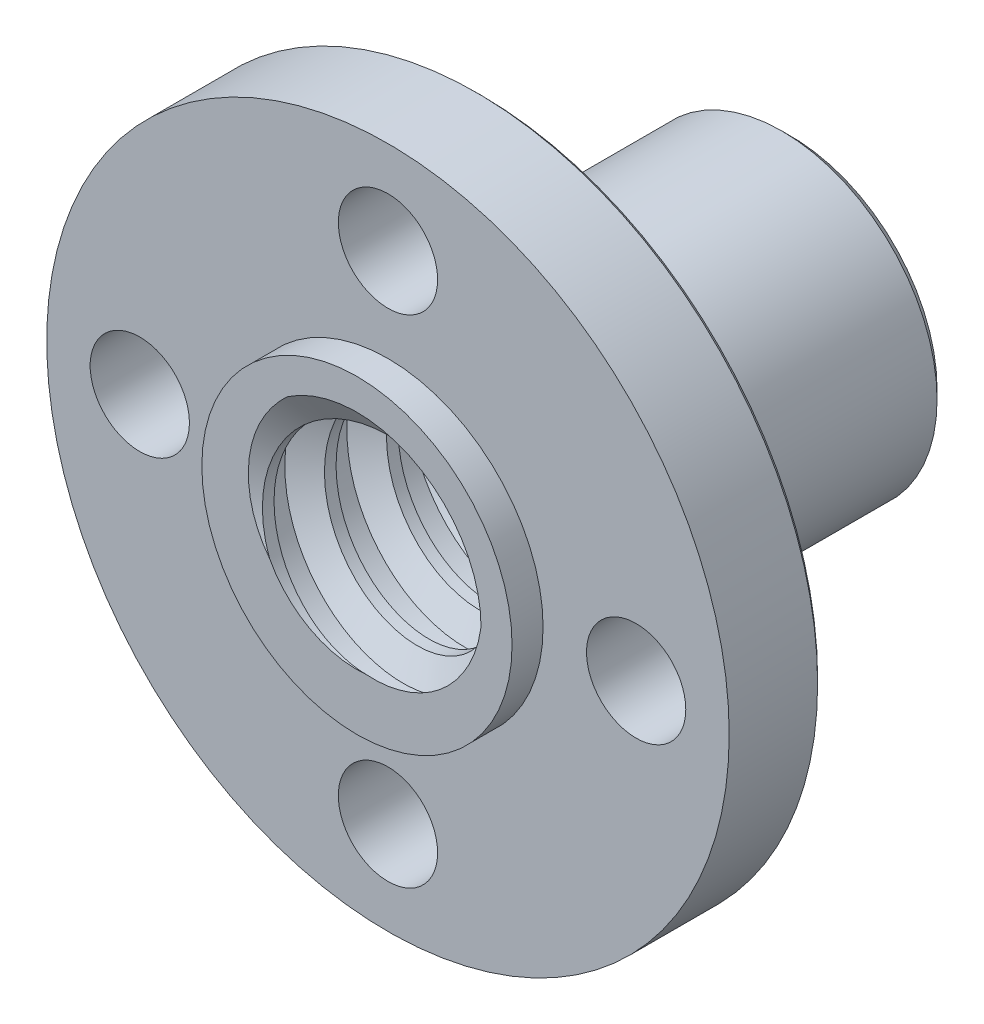
from build123d import *

# Parameters (mm, degrees)
SKETCH1_R           = 5
BOSS_EXTRUDE1_DEPTH = 14
CUT_EXTRUDE1_REACH  = 17.684
SKETCH3_R           = 4
THREAD7_PITCH       = 2
CUT_EXTRUDE2_START  = 14
SKETCH14_R          = 5
CUT_EXTRUDE2_DEPTH  = 14
SKETCH15_R          = 5
CUT_EXTRUDE3_DEPTH  = 14
BOSS_EXTRUDE2_START = -4
SKETCH16_R          = 11
SKETCH16_R_2        = 5
BOSS_EXTRUDE2_DEPTH = 3
CUT_EXTRUDE4_REACH  = 22.273
SKETCH17_R          = 1.6
CHAMFER1_SIZE       = 0.3
CHAMFER2_SIZE       = 0.15


with BuildPart() as part:
    # Sketch1 → Boss-Extrude1 (new body)
    with BuildSketch(Plane.XY):
        Circle(SKETCH1_R)
    extrude(amount=BOSS_EXTRUDE1_DEPTH)

    # Sketch3 → Cut-Extrude1 (cut, up to next)
    with BuildSketch(Plane(origin=(0, 0, 0), x_dir=(-1, 0, 0), z_dir=(0, 0, -1)), mode=Mode.PRIVATE) as cut_extrude1_sk1:
        Circle(SKETCH3_R)
    cut_extrude1_tool1 = extrude(cut_extrude1_sk1.sketch, amount=-CUT_EXTRUDE1_REACH, mode=Mode.PRIVATE) & part.part
    add(cut_extrude1_tool1.solids().sort_by_distance((0, 0, 0))[0], mode=Mode.SUBTRACT)

    # Thread7: the profile of Thread Profile5 profile screwed along a right-hand helix of 8 turns, 10 arcs to a turn; built about Z, then put on its axis
    thread7_z = Axis((0, 0, 0), (0, 0, 1))
    thread7_corners = [(4.0003, 0, -0.000173205), (4.0003, 0, 1.312673201), (3.188101188, 0, 0.843749998), (3.188101188, 0, 0.468749998)]
    with BuildLine(mode=Mode.PRIVATE) as thread7_profile:
        Line(thread7_corners[0], thread7_corners[1])
        Line(thread7_corners[1], thread7_corners[2])
        Line(thread7_corners[2], thread7_corners[3])
        Line(thread7_corners[3], thread7_corners[0])
    thread7_cap = Face(thread7_profile.wire())
    thread7_turn_angles = [0, 18, 36, 54, 72, 90, 108, 126, 144, 162, 180, 198, 216, 234, 252, 270, 288, 306, 324, 342, 360]
    thread7_turn_weights = [1, 0.9510565162951535, 1, 0.9510565162951535, 1, 0.9510565162951535, 1, 0.9510565162951535, 1, 0.9510565162951535, 1, 0.9510565162951535, 1, 0.9510565162951535, 1, 0.9510565162951535, 1, 0.9510565162951535, 1, 0.9510565162951535, 1]
    thread7_turn_rails = [Edge.make_bspline([Vector(p[0], p[1], 0).rotate(thread7_z, thread7_turn_angles[k]) / thread7_turn_weights[k] + Vector(0, 0, p[2] + THREAD7_PITCH * thread7_turn_angles[k] / 360) for k in range(21)], [0, 0, 0, 1, 1, 2, 2, 3, 3, 4, 4, 5, 5, 6, 6, 7, 7, 8, 8, 9, 9, 10, 10, 10], 2, thread7_turn_weights) for p in thread7_corners]
    thread7_turn_sides = [Face.make_surface_from_curves(thread7_turn_rails[p[0]], thread7_turn_rails[p[1]]) for p in [(0, 1), (1, 2), (2, 3), (3, 0)]]
    thread7 = Plane(origin=(0, 0, -2), x_dir=(1, 0, 0), z_dir=(0, 0, 1)) * Solid(Shell([*[p.moved(Location((0, 0, THREAD7_PITCH * i))) for i in range(8) for p in thread7_turn_sides], thread7_cap, thread7_cap.rotate(thread7_z, 2880).moved(Location((0, 0, THREAD7_PITCH * 2880 / 360)))]))
    add(thread7)

    # Sketch14 → Cut-Extrude2 (cut)
    with BuildSketch(Plane(origin=(0, 0, 0), x_dir=(-1, 0, 0), z_dir=(0, 0, -1)).offset(CUT_EXTRUDE2_START)):
        with Locations(Location((0, 0, 0), (0, 0, 180))):
            Circle(SKETCH14_R)
    extrude(amount=-CUT_EXTRUDE2_DEPTH, mode=Mode.SUBTRACT)

    # Sketch15 → Cut-Extrude3 (cut)
    with BuildSketch(Plane.XY.offset(14)):
        Circle(SKETCH15_R)
    extrude(amount=CUT_EXTRUDE3_DEPTH, mode=Mode.SUBTRACT)

    # Sketch16 → Boss-Extrude2 (add)
    with BuildSketch(Plane.XY.offset(14).offset(BOSS_EXTRUDE2_START)):
        Circle(SKETCH16_R)
        Circle(SKETCH16_R_2, mode=Mode.SUBTRACT)
    extrude(amount=BOSS_EXTRUDE2_DEPTH)

    # Sketch17 → Cut-Extrude4 (cut, up to next)
    with BuildSketch(Plane.XY.offset(13), mode=Mode.PRIVATE) as cut_extrude4_sk1:
        with Locations((0, 8)):
            Circle(SKETCH17_R)
    cut_extrude4_tool1 = extrude(cut_extrude4_sk1.sketch, amount=-CUT_EXTRUDE4_REACH, mode=Mode.PRIVATE) & part.part
    # Sketch17 → Cut-Extrude4 (cut, up to next)
    with BuildSketch(Plane.XY.offset(13), mode=Mode.PRIVATE) as cut_extrude4_sk2:
        with Locations((8, 0)):
            Circle(SKETCH17_R)
    cut_extrude4_tool2 = extrude(cut_extrude4_sk2.sketch, amount=-CUT_EXTRUDE4_REACH, mode=Mode.PRIVATE) & part.part
    # Sketch17 → Cut-Extrude4 (cut, up to next)
    with BuildSketch(Plane.XY.offset(13), mode=Mode.PRIVATE) as cut_extrude4_sk3:
        with Locations((0, -8)):
            Circle(SKETCH17_R)
    cut_extrude4_tool3 = extrude(cut_extrude4_sk3.sketch, amount=-CUT_EXTRUDE4_REACH, mode=Mode.PRIVATE) & part.part
    # Sketch17 → Cut-Extrude4 (cut, up to next)
    with BuildSketch(Plane.XY.offset(13), mode=Mode.PRIVATE) as cut_extrude4_sk4:
        with Locations((-8, 0)):
            Circle(SKETCH17_R)
    cut_extrude4_tool4 = extrude(cut_extrude4_sk4.sketch, amount=-CUT_EXTRUDE4_REACH, mode=Mode.PRIVATE) & part.part
    add(cut_extrude4_tool1.solids().sort_by_distance((0, 8, 13))[0], mode=Mode.SUBTRACT)
    add(cut_extrude4_tool2.solids().sort_by_distance((8, 0, 13))[0], mode=Mode.SUBTRACT)
    add(cut_extrude4_tool3.solids().sort_by_distance((0, -8, 13))[0], mode=Mode.SUBTRACT)
    add(cut_extrude4_tool4.solids().sort_by_distance((-8, 0, 13))[0], mode=Mode.SUBTRACT)

    # Chamfer1
    chamfer1_edges = [part.edges().sort_by_distance(p)[0] for p in [
        (-5, 0, 0),
    ]]
    chamfer(chamfer1_edges, length=CHAMFER1_SIZE)

    # Chamfer2
    chamfer2_edges = [part.edges().sort_by_distance(p)[0] for p in [
        (-11, 0, 10),
    ]]
    chamfer(chamfer2_edges, length=CHAMFER2_SIZE)


solid = part.part
